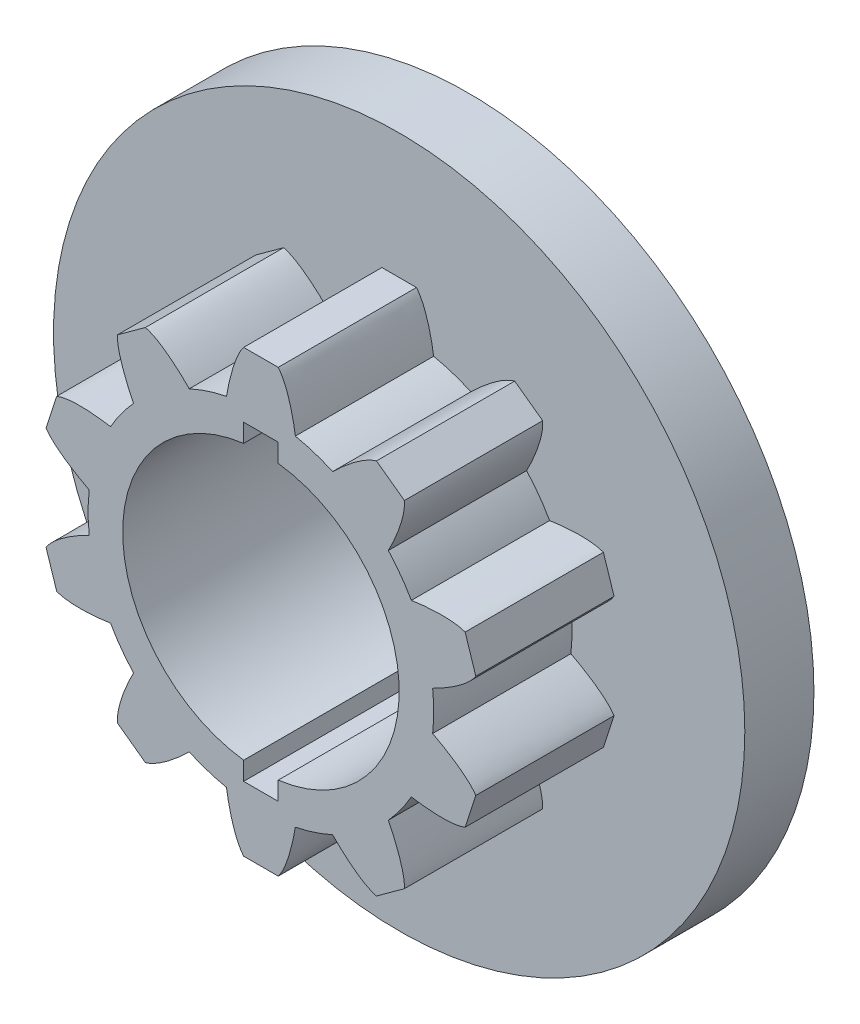
from build123d import *
from build123d.topology import SkipClean

# Parameters (mm, degrees)
SKETCH1_R           = 30
BOSS_EXTRUDE1_DEPTH = 10
BOSS_EXTRUDE2_DEPTH = 10
CIRPATTERN1_DEPTH   = 10
BOSS_EXTRUDE4_DEPTH = 8
CIRPATTERN2_COUNT   = 10
SKETCH3_R           = 34.614850266
SKETCH3_R_2         = 20
CUT_EXTRUDE1_DEPTH  = 10
CUT_EXTRUDE2_DEPTH  = 21
CUT_EXTRUDE3_START  = -6
SKETCH4_R           = 20
CUT_EXTRUDE3_DEPTH  = 6


# Read off the part's stored shape, not the designer's step: CirPattern1
with BuildPart() as part:
    # Sketch1 → Boss-Extrude1 (new body)
    with BuildSketch(Plane.XY):
        Circle(SKETCH1_R)
        with BuildLine():
            ThreePointArc((1, -7.937253933), (8, 0), (1, 7.937253933))
            Line((1, 7.937253933), (1, 9))
            Line((1, 9), (-1, 9))
            Line((-1, 9), (-1, 7.937253933))
            ThreePointArc((-1, 7.937253933), (-8, 0), (-1, -7.937253933))
            Line((-1, -7.937253933), (-1, -9))
            Line((-1, -9), (1, -9))
            Line((1, -9), (1, -7.937253933))
        make_face(mode=Mode.SUBTRACT)
    extrude(amount=BOSS_EXTRUDE1_DEPTH)

    # Sketch1<3> → Boss-Extrude2 (add)
    with BuildSketch(Plane.XY):
        with BuildLine():
            ThreePointArc((1.012083684, 33.98493323), (0.506097745, 33.996233101), (-3.37e-07, 34))
            ThreePointArc((-3.37e-07, 34), (-0.505863732, 33.996236584), (-1.011615139, 33.98494718))
            add(Edge.make_bspline(
                [(-1.011615139, 33.98494718), (-1.855460387, 32.888056738), (-2.349185813, 31.525158942), (-2.492791418, 29.896253795)],
                knots=[0.00448065, 0.00448065, 0.00448065, 0.00448065, 0.982900103, 0.982900103, 0.982900103, 0.982900103], degree=3))
            ThreePointArc((-2.492791418, 29.896253795), (0.004835323, 29.99999961), (2.502428492, 29.895448678))
            add(Edge.make_bspline(
                [(1.012083684, 33.98493323), (2.036760796, 32.704388911), (2.533542399, 31.341227394), (2.502428492, 29.895448678)],
                knots=[0.003833031, 0.003833031, 0.003833031, 0.003833031, 0.980908423, 0.980908423, 0.980908423, 0.980908423], degree=3))
        make_face()
    extrude(amount=BOSS_EXTRUDE2_DEPTH)

    # CirPattern1 outline → CirPattern1 (add)
    with BuildSketch(Plane.XY):
        with BuildLine():
            ThreePointArc((9.773545735, 32.564978178), (8.800073923, 32.841417432), (7.818806388, 33.08876345))
            add(Edge.make_bspline(
                [(7.818806388, 33.08876345), (6.719818333, 32.247651865), (5.890172287, 31.058979229), (5.329868249, 29.522745544)],
                knots=[0.00448065, 0.00448065, 0.00448065, 0.00448065, 0.982900103, 0.982900103, 0.982900103, 0.982900103], degree=3))
            ThreePointArc((5.329868249, 29.522745544), (7.769241816, 28.976522939), (10.154671788, 28.229109814))
            add(Edge.make_bspline(
                [(9.773545735, 32.564978178), (10.431878564, 31.062861398), (10.558920581, 29.617571943), (10.154671788, 28.229109814)],
                knots=[0.003833031, 0.003833031, 0.003833031, 0.003833031, 0.980908423, 0.980908423, 0.980908423, 0.980908423], degree=3))
        make_face()
        with BuildLine():
            add(Edge.make_bspline(
                [(-9.773096766, 32.565112922), (-10.304292547, 31.287194894), (-10.428450782, 29.842951172), (-10.145571469, 28.232381755)],
                knots=[0.00448065, 0.00448065, 0.00448065, 0.00448065, 0.982900103, 0.982900103, 0.982900103, 0.982900103], degree=3))
            ThreePointArc((-10.145571469, 28.232381755), (-7.759900689, 28.979025887), (-5.320351171, 29.52446212))
            add(Edge.make_bspline(
                [(-7.818350197, 33.088871244), (-6.497158854, 32.117166366), (-5.664492512, 30.929029992), (-5.320351171, 29.52446212)],
                knots=[0.003833031, 0.003833031, 0.003833031, 0.003833031, 0.980908423, 0.980908423, 0.980908423, 0.980908423], degree=3))
            ThreePointArc((-7.818350197, 33.088871244), (-8.799621143, 32.841538754), (-9.773096766, 32.565112922))
        make_face()
        with BuildLine():
            add(Edge.make_bspline(
                [(-17.868557999, 28.926020034), (-18.050904199, 27.554162422), (-17.797034063, 26.126995596), (-17.106947591, 24.644519555)],
                knots=[0.00448065, 0.00448065, 0.00448065, 0.00448065, 0.982900103, 0.982900103, 0.982900103, 0.982900103], degree=3))
            ThreePointArc((-17.106947591, 24.644519555), (-14.995812293, 25.983179438), (-12.780557694, 27.141432259))
            add(Edge.make_bspline(
                [(-16.115976433, 29.937857365), (-14.588307865, 29.34121201), (-13.476501618, 28.409070308), (-12.780557694, 27.141432259)],
                knots=[0.003833031, 0.003833031, 0.003833031, 0.003833031, 0.980908423, 0.980908423, 0.980908423, 0.980908423], degree=3))
            ThreePointArc((-16.115976433, 29.937857365), (-16.999797024, 29.444980916), (-17.868557999, 28.926020034))
        make_face()
        with BuildLine():
            add(Edge.make_bspline(
                [(-24.746306534, 23.315666684), (-24.567376561, 21.943359317), (-23.952778885, 20.630528448), (-22.902513506, 19.377174075)],
                knots=[0.00448065, 0.00448065, 0.00448065, 0.00448065, 0.982900103, 0.982900103, 0.982900103, 0.982900103], degree=3))
            ThreePointArc((-22.902513506, 19.377174075), (-21.209784071, 21.216622251), (-19.369790332, 22.908758643))
            add(Edge.make_bspline(
                [(-23.315325509, 24.746627981), (-21.685287803, 24.565702544), (-20.37010941, 23.953079431), (-19.369790332, 22.908758643)],
                knots=[0.003833031, 0.003833031, 0.003833031, 0.003833031, 0.980908423, 0.980908423, 0.980908423, 0.980908423], degree=3))
            ThreePointArc((-23.315325509, 24.746627981), (-24.041464831, 24.041796289), (-24.746306534, 23.315666684))
        make_face()
        with BuildLine():
            add(Edge.make_bspline(
                [(-29.937635174, 16.11638918), (-29.409622809, 14.837152538), (-28.476181409, 13.728124879), (-27.137310973, 12.789306203)],
                knots=[0.00448065, 0.00448065, 0.00448065, 0.00448065, 0.982900103, 0.982900103, 0.982900103, 0.982900103], degree=3))
            ThreePointArc((-27.137310973, 12.789306203), (-25.978344116, 15.004187319), (-24.639003768, 17.114890984))
            add(Edge.make_bspline(
                [(-28.925773681, 17.868956796), (-27.304451214, 18.116081046), (-25.875527909, 17.864725776), (-24.639003768, 17.114890984)],
                knots=[0.003833031, 0.003833031, 0.003833031, 0.003833031, 0.980908423, 0.980908423, 0.980908423, 0.980908423], degree=3))
            ThreePointArc((-28.925773681, 17.868956796), (-29.44474654, 17.000202975), (-29.937635174, 16.11638918))
        make_face()
        with BuildLine():
            add(Edge.make_bspline(
                [(-33.08876345, 7.818806388), (-32.247651865, 6.719818333), (-31.058979229, 5.890172287), (-29.522745544, 5.329868249)],
                knots=[0.00448065, 0.00448065, 0.00448065, 0.00448065, 0.982900103, 0.982900103, 0.982900103, 0.982900103], degree=3))
            ThreePointArc((-29.522745544, 5.329868249), (-28.97652294, 7.769241816), (-28.229109815, 10.154671789))
            add(Edge.make_bspline(
                [(-32.564978178, 9.773545735), (-31.062861398, 10.431878564), (-29.617571943, 10.558920581), (-28.229109815, 10.154671789)],
                knots=[0.003833031, 0.003833031, 0.003833031, 0.003833031, 0.980908423, 0.980908423, 0.980908423, 0.980908423], degree=3))
            ThreePointArc((-32.564978178, 9.773545735), (-32.841417432, 8.800073923), (-33.08876345, 7.818806388))
        make_face()
        with BuildLine():
            add(Edge.make_bspline(
                [(-33.98494718, -1.011615139), (-32.888056738, -1.855460387), (-31.525158942, -2.349185813), (-29.896253795, -2.492791418)],
                knots=[0.00448065, 0.00448065, 0.00448065, 0.00448065, 0.982900103, 0.982900103, 0.982900103, 0.982900103], degree=3))
            ThreePointArc((-29.896253795, -2.492791418), (-29.999999612, 0.004835323), (-29.895448679, 2.502428492))
            add(Edge.make_bspline(
                [(-33.98493323, 1.012083684), (-32.704388911, 2.036760796), (-31.341227394, 2.533542399), (-29.895448679, 2.502428492)],
                knots=[0.003833031, 0.003833031, 0.003833031, 0.003833031, 0.980908423, 0.980908423, 0.980908423, 0.980908423], degree=3))
            ThreePointArc((-33.98493323, 1.012083684), (-33.999999999, 0.000234376), (-33.98494718, -1.011615139))
        make_face()
        with BuildLine():
            add(Edge.make_bspline(
                [(-32.565112922, -9.773096766), (-31.287194894, -10.304292547), (-29.842951172, -10.428450782), (-28.232381755, -10.145571469)],
                knots=[0.00448065, 0.00448065, 0.00448065, 0.00448065, 0.982900103, 0.982900103, 0.982900103, 0.982900103], degree=3))
            ThreePointArc((-28.232381755, -10.145571469), (-28.979025887, -7.759900689), (-29.52446212, -5.320351171))
            add(Edge.make_bspline(
                [(-33.088871244, -7.818350197), (-32.117166366, -6.497158854), (-30.929029992, -5.664492512), (-29.52446212, -5.320351171)],
                knots=[0.003833031, 0.003833031, 0.003833031, 0.003833031, 0.980908423, 0.980908423, 0.980908423, 0.980908423], degree=3))
            ThreePointArc((-33.088871244, -7.818350197), (-32.841538754, -8.799621143), (-32.565112922, -9.773096766))
        make_face()
        with BuildLine():
            add(Edge.make_bspline(
                [(-28.926020034, -17.868557999), (-27.554162422, -18.050904199), (-26.126995596, -17.797034063), (-24.644519555, -17.106947591)],
                knots=[0.00448065, 0.00448065, 0.00448065, 0.00448065, 0.982900103, 0.982900103, 0.982900103, 0.982900103], degree=3))
            ThreePointArc((-24.644519555, -17.106947591), (-25.983179438, -14.995812293), (-27.141432259, -12.780557694))
            add(Edge.make_bspline(
                [(-29.937857365, -16.115976433), (-29.34121201, -14.588307865), (-28.409070308, -13.476501618), (-27.141432259, -12.780557694)],
                knots=[0.003833031, 0.003833031, 0.003833031, 0.003833031, 0.980908423, 0.980908423, 0.980908423, 0.980908423], degree=3))
            ThreePointArc((-29.937857365, -16.115976433), (-29.444980916, -16.999797024), (-28.926020034, -17.868557999))
        make_face()
        with BuildLine():
            add(Edge.make_bspline(
                [(-23.315666684, -24.746306534), (-21.943359317, -24.567376561), (-20.630528448, -23.952778885), (-19.377174075, -22.902513506)],
                knots=[0.00448065, 0.00448065, 0.00448065, 0.00448065, 0.982900103, 0.982900103, 0.982900103, 0.982900103], degree=3))
            ThreePointArc((-19.377174075, -22.902513506), (-21.21662225, -21.209784071), (-22.908758643, -19.369790331))
            add(Edge.make_bspline(
                [(-24.746627981, -23.315325509), (-24.565702544, -21.685287803), (-23.953079431, -20.37010941), (-22.908758643, -19.369790331)],
                knots=[0.003833031, 0.003833031, 0.003833031, 0.003833031, 0.980908423, 0.980908423, 0.980908423, 0.980908423], degree=3))
            ThreePointArc((-24.746627981, -23.315325509), (-24.041796289, -24.041464831), (-23.315666684, -24.746306534))
        make_face()
        with BuildLine():
            add(Edge.make_bspline(
                [(-16.11638918, -29.937635174), (-14.837152538, -29.409622809), (-13.728124879, -28.476181409), (-12.789306203, -27.137310973)],
                knots=[0.00448065, 0.00448065, 0.00448065, 0.00448065, 0.982900103, 0.982900103, 0.982900103, 0.982900103], degree=3))
            ThreePointArc((-12.789306203, -27.137310973), (-15.004187318, -25.978344115), (-17.114890984, -24.639003767))
            add(Edge.make_bspline(
                [(-17.868956796, -28.925773681), (-18.116081046, -27.304451214), (-17.864725776, -25.875527909), (-17.114890984, -24.639003767)],
                knots=[0.003833031, 0.003833031, 0.003833031, 0.003833031, 0.980908423, 0.980908423, 0.980908423, 0.980908423], degree=3))
            ThreePointArc((-17.868956796, -28.925773681), (-17.000202975, -29.44474654), (-16.11638918, -29.937635174))
        make_face()
        with BuildLine():
            add(Edge.make_bspline(
                [(-7.818806388, -33.08876345), (-6.719818333, -32.247651865), (-5.890172287, -31.058979229), (-5.329868249, -29.522745544)],
                knots=[0.00448065, 0.00448065, 0.00448065, 0.00448065, 0.982900103, 0.982900103, 0.982900103, 0.982900103], degree=3))
            ThreePointArc((-5.329868249, -29.522745544), (-7.769241816, -28.976522939), (-10.154671788, -28.229109814))
            add(Edge.make_bspline(
                [(-9.773545735, -32.564978178), (-10.431878564, -31.062861398), (-10.558920581, -29.617571943), (-10.154671788, -28.229109814)],
                knots=[0.003833031, 0.003833031, 0.003833031, 0.003833031, 0.980908423, 0.980908423, 0.980908423, 0.980908423], degree=3))
            ThreePointArc((-9.773545735, -32.564978178), (-8.800073923, -32.841417432), (-7.818806388, -33.08876345))
        make_face()
        with BuildLine():
            add(Edge.make_bspline(
                [(1.011615139, -33.98494718), (1.855460387, -32.888056738), (2.349185813, -31.525158942), (2.492791418, -29.896253795)],
                knots=[0.00448065, 0.00448065, 0.00448065, 0.00448065, 0.982900103, 0.982900103, 0.982900103, 0.982900103], degree=3))
            ThreePointArc((2.492791418, -29.896253795), (-0.004835323, -29.99999961), (-2.502428492, -29.895448678))
            add(Edge.make_bspline(
                [(-1.012083684, -33.98493323), (-2.036760796, -32.704388911), (-2.533542399, -31.341227394), (-2.502428492, -29.895448678)],
                knots=[0.003833031, 0.003833031, 0.003833031, 0.003833031, 0.980908423, 0.980908423, 0.980908423, 0.980908423], degree=3))
            ThreePointArc((-1.012083684, -33.98493323), (-0.000234376, -33.999999999), (1.011615139, -33.98494718))
        make_face()
        with BuildLine():
            add(Edge.make_bspline(
                [(9.773096766, -32.565112922), (10.304292547, -31.287194894), (10.428450782, -29.842951172), (10.145571469, -28.232381755)],
                knots=[0.00448065, 0.00448065, 0.00448065, 0.00448065, 0.982900103, 0.982900103, 0.982900103, 0.982900103], degree=3))
            ThreePointArc((10.145571469, -28.232381755), (7.759900689, -28.979025885), (5.320351171, -29.524462118))
            add(Edge.make_bspline(
                [(7.818350197, -33.088871244), (6.497158854, -32.117166366), (5.664492512, -30.929029992), (5.320351171, -29.524462118)],
                knots=[0.003833031, 0.003833031, 0.003833031, 0.003833031, 0.980908423, 0.980908423, 0.980908423, 0.980908423], degree=3))
            ThreePointArc((7.818350197, -33.088871244), (8.799621143, -32.841538754), (9.773096766, -32.565112922))
        make_face()
        with BuildLine():
            add(Edge.make_bspline(
                [(17.868557999, -28.926020034), (18.050904199, -27.554162422), (17.797034063, -26.126995596), (17.106947591, -24.644519555)],
                knots=[0.00448065, 0.00448065, 0.00448065, 0.00448065, 0.982900103, 0.982900103, 0.982900103, 0.982900103], degree=3))
            ThreePointArc((17.106947591, -24.644519555), (14.995812292, -25.983179437), (12.780557694, -27.141432258))
            add(Edge.make_bspline(
                [(16.115976433, -29.937857365), (14.588307865, -29.34121201), (13.476501618, -28.409070308), (12.780557694, -27.141432258)],
                knots=[0.003833031, 0.003833031, 0.003833031, 0.003833031, 0.980908423, 0.980908423, 0.980908423, 0.980908423], degree=3))
            ThreePointArc((16.115976433, -29.937857365), (16.999797024, -29.444980916), (17.868557999, -28.926020034))
        make_face()
        with BuildLine():
            add(Edge.make_bspline(
                [(24.746306534, -23.315666684), (24.567376561, -21.943359317), (23.952778885, -20.630528448), (22.902513506, -19.377174075)],
                knots=[0.00448065, 0.00448065, 0.00448065, 0.00448065, 0.982900103, 0.982900103, 0.982900103, 0.982900103], degree=3))
            ThreePointArc((22.902513506, -19.377174075), (21.209784069, -21.216622249), (19.36979033, -22.908758642))
            add(Edge.make_bspline(
                [(23.315325509, -24.746627981), (21.685287803, -24.565702544), (20.37010941, -23.953079431), (19.36979033, -22.908758642)],
                knots=[0.003833031, 0.003833031, 0.003833031, 0.003833031, 0.980908423, 0.980908423, 0.980908423, 0.980908423], degree=3))
            ThreePointArc((23.315325509, -24.746627981), (24.041464831, -24.041796289), (24.746306534, -23.315666684))
        make_face()
        with BuildLine():
            add(Edge.make_bspline(
                [(29.937635174, -16.11638918), (29.409622809, -14.837152538), (28.476181409, -13.728124879), (27.137310973, -12.789306203)],
                knots=[0.00448065, 0.00448065, 0.00448065, 0.00448065, 0.982900103, 0.982900103, 0.982900103, 0.982900103], degree=3))
            ThreePointArc((27.137310973, -12.789306203), (25.978344113, -15.004187317), (24.639003766, -17.114890983))
            add(Edge.make_bspline(
                [(28.925773681, -17.868956796), (27.304451214, -18.116081046), (25.875527909, -17.864725776), (24.639003766, -17.114890983)],
                knots=[0.003833031, 0.003833031, 0.003833031, 0.003833031, 0.980908423, 0.980908423, 0.980908423, 0.980908423], degree=3))
            ThreePointArc((28.925773681, -17.868956796), (29.44474654, -17.000202975), (29.937635174, -16.11638918))
        make_face()
        with BuildLine():
            add(Edge.make_bspline(
                [(33.08876345, -7.818806388), (32.247651865, -6.719818333), (31.058979229, -5.890172287), (29.522745544, -5.329868249)],
                knots=[0.00448065, 0.00448065, 0.00448065, 0.00448065, 0.982900103, 0.982900103, 0.982900103, 0.982900103], degree=3))
            ThreePointArc((29.522745544, -5.329868249), (28.976522937, -7.769241815), (28.229109813, -10.154671788))
            add(Edge.make_bspline(
                [(32.564978178, -9.773545735), (31.062861398, -10.431878564), (29.617571943, -10.558920581), (28.229109813, -10.154671788)],
                knots=[0.003833031, 0.003833031, 0.003833031, 0.003833031, 0.980908423, 0.980908423, 0.980908423, 0.980908423], degree=3))
            ThreePointArc((32.564978178, -9.773545735), (32.841417432, -8.800073923), (33.08876345, -7.818806388))
        make_face()
        with BuildLine():
            add(Edge.make_bspline(
                [(33.98494718, 1.011615139), (32.888056738, 1.855460387), (31.525158942, 2.349185813), (29.896253795, 2.492791418)],
                knots=[0.00448065, 0.00448065, 0.00448065, 0.00448065, 0.982900103, 0.982900103, 0.982900103, 0.982900103], degree=3))
            ThreePointArc((29.896253795, 2.492791418), (29.999999609, -0.004835323), (29.895448677, -2.502428491))
            add(Edge.make_bspline(
                [(33.98493323, -1.012083684), (32.704388911, -2.036760796), (31.341227394, -2.533542399), (29.895448677, -2.502428491)],
                knots=[0.003833031, 0.003833031, 0.003833031, 0.003833031, 0.980908423, 0.980908423, 0.980908423, 0.980908423], degree=3))
            ThreePointArc((33.98493323, -1.012083684), (33.999999999, -0.000234376), (33.98494718, 1.011615139))
        make_face()
        with BuildLine():
            add(Edge.make_bspline(
                [(32.565112922, 9.773096766), (31.287194894, 10.304292547), (29.842951172, 10.428450782), (28.232381755, 10.145571469)],
                knots=[0.00448065, 0.00448065, 0.00448065, 0.00448065, 0.982900103, 0.982900103, 0.982900103, 0.982900103], degree=3))
            ThreePointArc((28.232381755, 10.145571469), (28.979025885, 7.759900688), (29.524462118, 5.320351171))
            add(Edge.make_bspline(
                [(33.088871244, 7.818350197), (32.117166366, 6.497158854), (30.929029992, 5.664492512), (29.524462118, 5.320351171)],
                knots=[0.003833031, 0.003833031, 0.003833031, 0.003833031, 0.980908423, 0.980908423, 0.980908423, 0.980908423], degree=3))
            ThreePointArc((33.088871244, 7.818350197), (32.841538754, 8.799621143), (32.565112922, 9.773096766))
        make_face()
        with BuildLine():
            add(Edge.make_bspline(
                [(28.926020034, 17.868557999), (27.554162422, 18.050904199), (26.126995596, 17.797034063), (24.644519555, 17.106947591)],
                knots=[0.00448065, 0.00448065, 0.00448065, 0.00448065, 0.982900103, 0.982900103, 0.982900103, 0.982900103], degree=3))
            ThreePointArc((24.644519555, 17.106947591), (25.983179437, 14.995812292), (27.141432257, 12.780557694))
            add(Edge.make_bspline(
                [(29.937857365, 16.115976433), (29.34121201, 14.588307865), (28.409070308, 13.476501618), (27.141432257, 12.780557694)],
                knots=[0.003833031, 0.003833031, 0.003833031, 0.003833031, 0.980908423, 0.980908423, 0.980908423, 0.980908423], degree=3))
            ThreePointArc((29.937857365, 16.115976433), (29.444980916, 16.999797024), (28.926020034, 17.868557999))
        make_face()
        with BuildLine():
            add(Edge.make_bspline(
                [(23.315666684, 24.746306534), (21.943359317, 24.567376561), (20.630528448, 23.952778885), (19.377174075, 22.902513506)],
                knots=[0.00448065, 0.00448065, 0.00448065, 0.00448065, 0.982900103, 0.982900103, 0.982900103, 0.982900103], degree=3))
            ThreePointArc((19.377174075, 22.902513506), (21.216622249, 21.20978407), (22.908758642, 19.36979033))
            add(Edge.make_bspline(
                [(24.746627981, 23.315325509), (24.565702544, 21.685287803), (23.953079431, 20.37010941), (22.908758642, 19.36979033)],
                knots=[0.003833031, 0.003833031, 0.003833031, 0.003833031, 0.980908423, 0.980908423, 0.980908423, 0.980908423], degree=3))
            ThreePointArc((24.746627981, 23.315325509), (24.041796289, 24.041464831), (23.315666684, 24.746306534))
        make_face()
        with BuildLine():
            add(Edge.make_bspline(
                [(16.11638918, 29.937635174), (14.837152538, 29.409622809), (13.728124879, 28.476181409), (12.789306203, 27.137310973)],
                knots=[0.00448065, 0.00448065, 0.00448065, 0.00448065, 0.982900103, 0.982900103, 0.982900103, 0.982900103], degree=3))
            ThreePointArc((12.789306203, 27.137310973), (15.004187318, 25.978344114), (17.114890983, 24.639003766))
            add(Edge.make_bspline(
                [(17.868956796, 28.925773681), (18.116081046, 27.304451214), (17.864725776, 25.875527909), (17.114890983, 24.639003766)],
                knots=[0.003833031, 0.003833031, 0.003833031, 0.003833031, 0.980908423, 0.980908423, 0.980908423, 0.980908423], degree=3))
            ThreePointArc((17.868956796, 28.925773681), (17.000202975, 29.44474654), (16.11638918, 29.937635174))
        make_face()
    extrude(amount=CIRPATTERN1_DEPTH)

    # Sketch2 → Boss-Extrude4 (add)
    with BuildSketch(Plane.XY.offset(10)):
        with BuildLine():
            Line((-1, 12.749121765), (1, 12.749121765))
            add(Edge.make_bspline(
                [(1, 12.749121765), (1.551540037, 12.095573804), (1.882350295, 10.612952368), (1.992430772, 9.799500988)],
                knots=[0, 0, 0, 0, 0.976483073, 0.976483073, 0.976483073, 0.976483073], degree=3))
            ThreePointArc((1.992430772, 9.799500988), (-0.000749367, -9.999999972), (-1.990962066, 9.79979949))
            add(Edge.make_bspline(
                [(-1, 12.749121765), (-1.534746296, 12.072275537), (-1.865066984, 10.589753602), (-1.990962066, 9.79979949)],
                knots=[0, 0, 0, 0, 0.975667075, 0.975667075, 0.975667075, 0.975667075], degree=3))
        make_face()
    boss_extrude4 = extrude(amount=BOSS_EXTRUDE4_DEPTH)

    # CirPattern2: Boss-Extrude4 ×10 about axis
    cirpattern2_axis = Axis((0, 0, 18), (0, 0, -1))
    for i in range(1, CIRPATTERN2_COUNT):
        add(boss_extrude4.rotate(cirpattern2_axis, i * 360 / CIRPATTERN2_COUNT))

    # Sketch3 → Cut-Extrude1 (cut)
    with BuildSketch(Plane.XY.offset(10)):
        Circle(SKETCH3_R)
        Circle(SKETCH3_R_2, mode=Mode.SUBTRACT)
    extrude(amount=-CUT_EXTRUDE1_DEPTH, mode=Mode.SUBTRACT)

    # Sketch1<4> → Cut-Extrude2 (cut)
    with SkipClean():  # the faces are left unmerged after this step: merging them gives an invalid solid
        with BuildSketch(Plane.XY):
            with BuildLine():
                Line((-1, 9), (1, 9))
                Line((1, 9), (1, 7.937253933))
                ThreePointArc((1, 7.937253933), (8, 0), (1, -7.937253933))
                Line((1, -7.937253933), (1, -9))
                Line((1, -9), (-1, -9))
                Line((-1, -9), (-1, -7.937253933))
                ThreePointArc((-1, -7.937253933), (-8, 0), (-1, 7.937253933))
                Line((-1, 7.937253933), (-1, 9))
            make_face()
        extrude(amount=CUT_EXTRUDE2_DEPTH, mode=Mode.SUBTRACT)
    add(part.part.scale(1), mode=Mode.REPLACE)  # the faces are merged on a copy

    # Sketch4 → Cut-Extrude3 (cut)
    with BuildSketch(Plane(origin=(0, 0, 0), x_dir=(-1, 0, 0), z_dir=(0, 0, -1)).offset(CUT_EXTRUDE3_START)):
        with Locations(Location((0, 0, 0), (0, 0, 180))):
            Circle(SKETCH4_R)
    extrude(amount=CUT_EXTRUDE3_DEPTH, mode=Mode.SUBTRACT)


solid = part.part
